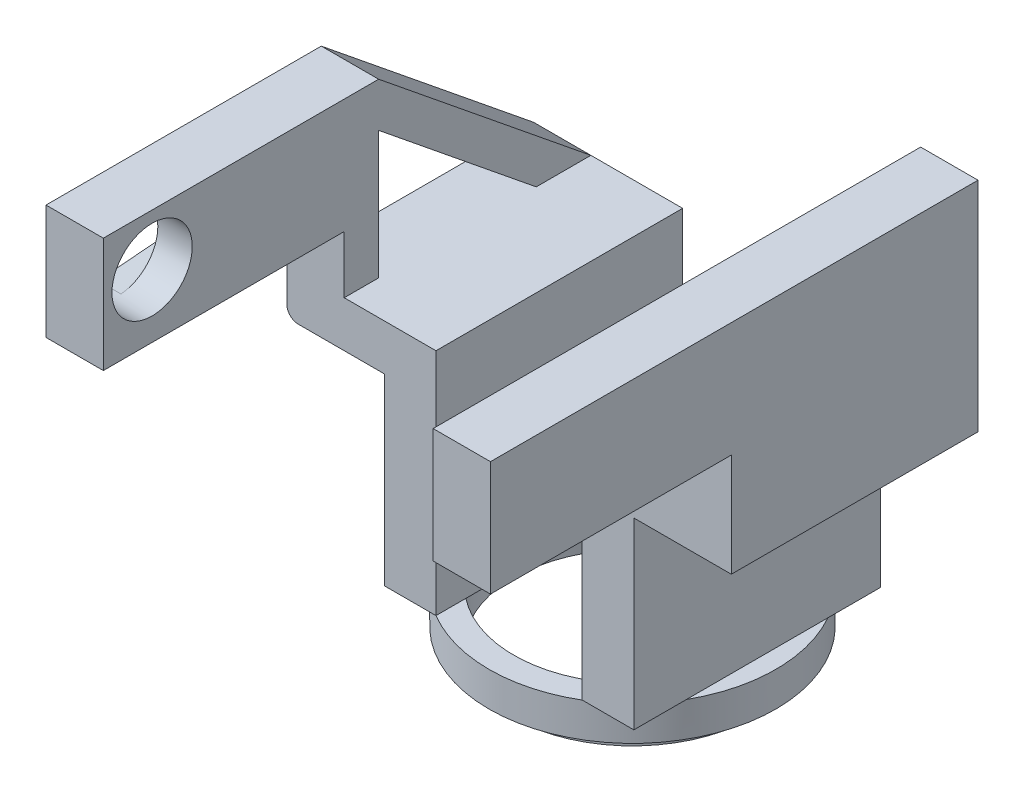
from build123d import *
from build123d.topology import SkipClean

# Parameters (mm, degrees)
SKETCH_1_R           = 10.65
SKETCH_1_R_2         = 10.35
EXTRUDE_1_DEPTH      = 1.5
SKETCH_2_R           = 12.5
SKETCH_2_R_2         = 10.35
EXTRUDE_2_DEPTH      = 3
SKETCH_3_W           = 4.5
SKETCH_3_H           = 21.504360024
EXTRUDE_3_DEPTH      = 20
SKETCH_5_OUTSIDE_W   = 35.602
SKETCH_5_OUTSIDE_H   = 35.602
SKETCH_5_OUTSIDE_R   = 12.5
CUT_EXTRUDE_3_DEPTH  = 23
SKETCH_7_W           = 21.504360024
SKETCH_7_H           = 4
EXTRUDE_5_DEPTH      = 13
SKETCH_9_W           = 5
SKETCH_9_H           = 21.504360024
EXTRUDE_6_DEPTH      = 15
CUT_EXTRUDE_4_DEPTH  = 12
FILLET_4_R           = 1
SKETCH_11_W          = 5
SKETCH_11_H          = 10
EXTRUDE_7_DEPTH      = 21
SKETCH_12_R          = 3.5
CUT_EXTRUDE_9_DEPTH  = 5
CUT_EXTRUDE_10_DEPTH = 2
SKETCH_13_R          = 2.5
CUT_EXTRUDE_11_DEPTH = 3


with BuildPart() as part:
    # 草图1 → 凸台-拉伸1 (new body)
    with BuildSketch(Plane(origin=(0, 0, 0), x_dir=(1, 0, 0), z_dir=(0, 1, 0))):
        Circle(SKETCH_1_R)
        Circle(SKETCH_1_R_2, mode=Mode.SUBTRACT)
    extrude(amount=EXTRUDE_1_DEPTH)

    # 草图2 → 凸台-拉伸2 (add)
    with BuildSketch(Plane(origin=(0, 1.5, 0), x_dir=(1, 0, 0), z_dir=(0, 1, 0))):
        Circle(SKETCH_2_R)
        Circle(SKETCH_2_R_2, mode=Mode.SUBTRACT)
    extrude(amount=EXTRUDE_2_DEPTH)

    # 草图3 → 凸台-拉伸3 (add)
    with BuildSketch(Plane(origin=(0, 4.5, 0), x_dir=(1, 0, 0), z_dir=(0, 1, 0))):
        with Locations((8.625, 0)):
            Rectangle(SKETCH_3_W, SKETCH_3_H)
        with Locations((-8.625, 0)):
            Rectangle(SKETCH_3_W, SKETCH_3_H)
    extrude_3 = extrude(amount=EXTRUDE_3_DEPTH)

    # 草图5 outside → 切除-拉伸3 (cut)
    with SkipClean():  # the faces are left unmerged after this step: merging them gives an invalid solid
        with BuildSketch(Plane(origin=(0, 1.5, 0), x_dir=(-1, 0, 0), z_dir=(0, -1, 0))):
            Rectangle(SKETCH_5_OUTSIDE_W, SKETCH_5_OUTSIDE_H)
            Circle(SKETCH_5_OUTSIDE_R, mode=Mode.SUBTRACT)
        extrude(amount=-CUT_EXTRUDE_3_DEPTH, mode=Mode.SUBTRACT)

    # 草图7 → 凸台-拉伸5 (add)
    with SkipClean():  # the faces are left unmerged after this step: merging them gives an invalid solid
        with BuildSketch(Plane(origin=(-6.375, 0, 0), x_dir=(0, 0, -1), z_dir=(1, 0, 0))):
            with Locations((0, 22.5)):
                Rectangle(SKETCH_7_W, SKETCH_7_H)
        extrude_5 = extrude(amount=-EXTRUDE_5_DEPTH)

    # 草图9 → 凸台-拉伸6 (add)
    with SkipClean():  # the faces are left unmerged after this step: merging them gives an invalid solid
        with BuildSketch(Plane(origin=(0, 24.5, 0), x_dir=(1, 0, 0), z_dir=(0, 1, 0))):
            with Locations((-16.875, 0)):
                Rectangle(SKETCH_9_W, SKETCH_9_H)
        extrude_6 = extrude(amount=EXTRUDE_6_DEPTH)

    # 草图10 → 切除-拉伸4 (cut)
    with SkipClean():  # the faces are left unmerged after this step: merging them gives an invalid solid
        with BuildSketch(Plane.ZY.offset(19.375)):
            Polygon((-10.752180012, 24.5), (7.752180012, 39.5), (-10.752180012, 39.5), align=None)
            Polygon((7.752180012, 35.638142979), (-5.9881005, 24.5), (7.752180012, 24.5), align=None)
        extrude(amount=-CUT_EXTRUDE_4_DEPTH, mode=Mode.SUBTRACT)

    # 圆角4
    fillet_4_edges = [part.edges().sort_by_distance(p)[0] for p in [
        (-19.375, 20.5, 0),
    ]]
    fillet(fillet_4_edges, radius=FILLET_4_R)

    # 草图11 → 凸台-拉伸7 (add)
    with BuildSketch(Plane.XY.offset(10.752180012)):
        with Locations((-16.875, 34.5)):
            Rectangle(SKETCH_11_W, SKETCH_11_H)
    extrude_7 = extrude(amount=EXTRUDE_7_DEPTH)

    # 草图12 → 切除-拉伸9 (cut)
    with BuildSketch(Plane.ZY.offset(19.375)):
        with Locations((27.502180012, 35)):
            Circle(SKETCH_12_R)
    extrude(amount=-CUT_EXTRUDE_9_DEPTH, mode=Mode.SUBTRACT)

    # 草图12<10> → 切除-拉伸10 (cut)
    with BuildSketch(Plane.ZY.offset(19.375)):
        with BuildLine():
            Line((27.213944717, 38.488111296), (10.329238835, 37.092866778))
            ThreePointArc((10.329238835, 37.092866778), (8.402180012, 35), (10.329238835, 32.907133222))
            Line((10.329238835, 32.907133222), (27.213944717, 31.511888704))
            ThreePointArc((27.213944717, 31.511888704), (24.002180012, 35), (27.213944717, 38.488111296))
        make_face()
    extrude(amount=-CUT_EXTRUDE_10_DEPTH, mode=Mode.SUBTRACT)

    # 镜向1: 凸台-拉伸3, 凸台-拉伸5, 凸台-拉伸6, 凸台-拉伸7 across plane
    add(extrude_3.mirror(Plane(origin=(0, 0, 0), x_dir=(0, 0, 1), z_dir=(1, 0, 0))))
    add(extrude_5.mirror(Plane(origin=(0, 0, 0), x_dir=(0, 0, 1), z_dir=(1, 0, 0))))
    add(extrude_6.mirror(Plane(origin=(0, 0, 0), x_dir=(0, 0, 1), z_dir=(1, 0, 0))))
    add(extrude_7.mirror(Plane(origin=(0, 0, 0), x_dir=(0, 0, 1), z_dir=(1, 0, 0))))

    # 草图13 → 切除-拉伸11 (cut)
    with BuildSketch(Plane.ZY.offset(-14.375)):
        with Locations((27.502180012, 35)):
            Circle(SKETCH_13_R)
    extrude(amount=-CUT_EXTRUDE_11_DEPTH, mode=Mode.SUBTRACT)


solid = part.part
